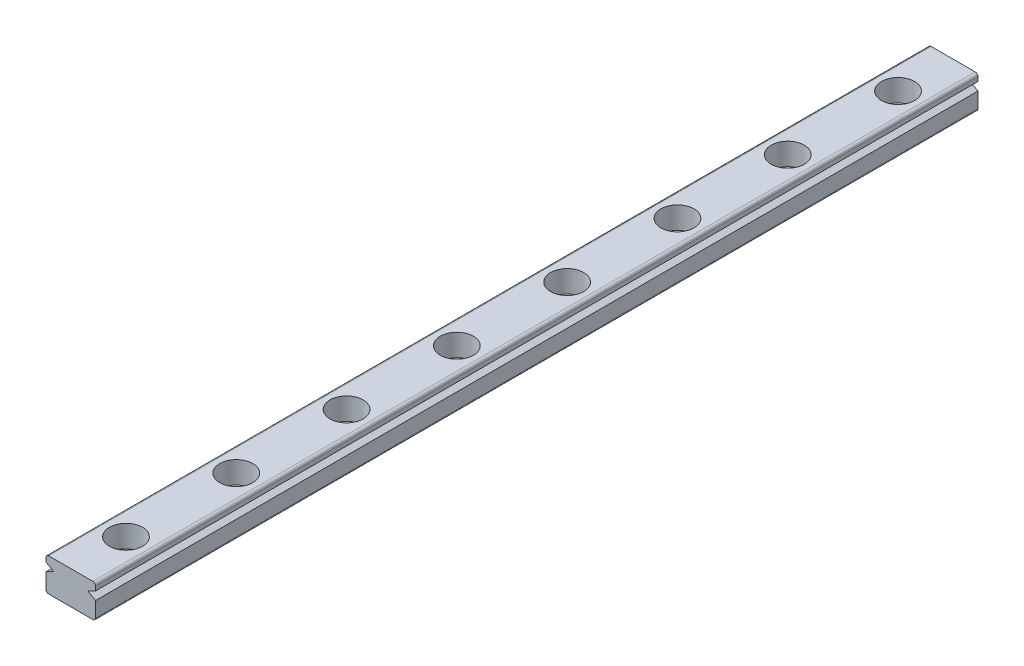
from build123d import *

# Parameters (mm, degrees)
BOSS_EXTRUDE1_DEPTH = 160
FILLET1_R           = 0.5
SKETCH2_R           = 3
CUT_EXTRUDE1_DEPTH  = 4
SKETCH3_R           = 1.75
CUT_EXTRUDE2_DEPTH  = 161.113241176
LPATTERN1_COUNT     = 8
LPATTERN1_PITCH     = 20


with BuildPart() as part:
    # Sketch1 → Boss-Extrude1 (new body)
    with BuildSketch(Plane.XY):
        Polygon((-4.5, 0), (4.5, 0), (4.5, 3.25), (3.1, 4), (4.5, 4.75), (4.5, 6), (-4.5, 6), (-4.5, 4.75), (-3.1, 4), (-4.5, 3.25), align=None)
    extrude(amount=BOSS_EXTRUDE1_DEPTH)

    # Fillet1
    fillet1_edges = [part.edges().sort_by_distance(p)[0] for p in [
        (4.5, 0, 80),
        (-4.5, 0, 80),
        (-4.5, 6, 80),
        (4.5, 6, 80),
    ]]
    fillet(fillet1_edges, radius=FILLET1_R)

    # Sketch2 → Cut-Extrude1 (cut)
    with BuildSketch(Plane(origin=(0, 6, 0), x_dir=(1, 0, 0), z_dir=(0, 1, 0))):
        with Locations((0, -10)):
            Circle(SKETCH2_R)
    cut_extrude1 = extrude(amount=-CUT_EXTRUDE1_DEPTH, mode=Mode.SUBTRACT)

    # Sketch3 → Cut-Extrude2 (cut, through all)
    with BuildSketch(Plane(origin=(0, 2, 0), x_dir=(1, 0, 0), z_dir=(0, 1, 0))):
        with Locations((0, -10)):
            Circle(SKETCH3_R)
    cut_extrude2 = extrude(amount=-CUT_EXTRUDE2_DEPTH, mode=Mode.SUBTRACT)

    # LPattern1: Cut-Extrude1, Cut-Extrude2 ×8
    with Locations(*[(0, 0, i * LPATTERN1_PITCH) for i in range(1, LPATTERN1_COUNT)]):
        add(cut_extrude1, mode=Mode.SUBTRACT)
        add(cut_extrude2, mode=Mode.SUBTRACT)


solid = part.part
